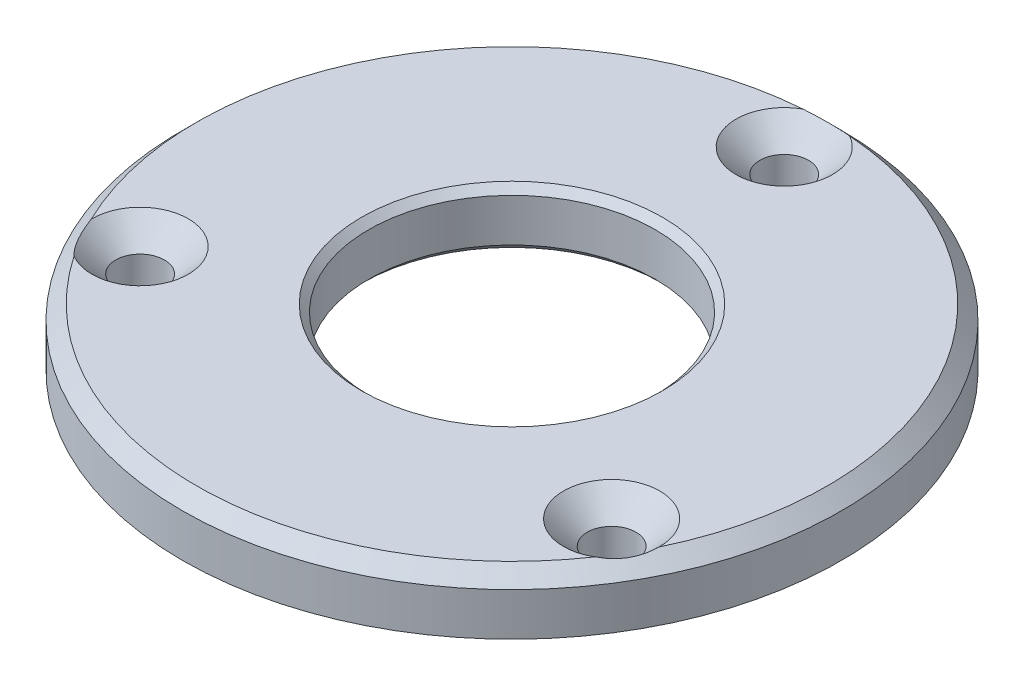
from build123d import *

# Parameters (mm, degrees)
SKETCH1_R                     = 23
SKETCH1_R_2                   = 10
BOSS_EXTRUDE1_DEPTH           = 4
CHAMFER1_SIZE                 = 0.5
CHAMFER2_SIZE                 = 1
CSK_FOR_M3_SFHCS1_D           = 3.4
CSK_FOR_M3_SFHCS1_CSINK_D     = 6.72
CSK_FOR_M3_SFHCS1_CSINK_ANGLE = 90


with BuildPart() as part:
    # Sketch1 → Boss-Extrude1 (new body)
    with BuildSketch(Plane(origin=(0, 0, 0), x_dir=(1, 0, 0), z_dir=(0, 1, 0))):
        Circle(SKETCH1_R)
        Circle(SKETCH1_R_2, mode=Mode.SUBTRACT)
    extrude(amount=BOSS_EXTRUDE1_DEPTH)

    # Chamfer1
    chamfer1_edges = [part.edges().sort_by_distance(p)[0] for p in [
        (-10, 0, 0),
        (-10, 4, 0),
    ]]
    chamfer(chamfer1_edges, length=CHAMFER1_SIZE)

    # Chamfer2
    chamfer2_edges = [part.edges().sort_by_distance(p)[0] for p in [
        (-23, 4, 0),
    ]]
    chamfer(chamfer2_edges, length=CHAMFER2_SIZE)

    # CSK for M3 SFHCS1 (through all)
    with Locations(Plane(origin=(0, 4, 0), x_dir=(1, 0, 0), z_dir=(0, 1, 0))):
        with Locations((0, 19), (16.454482672, -9.5), (-16.454482672, -9.5)):
            CounterSinkHole(CSK_FOR_M3_SFHCS1_D / 2, CSK_FOR_M3_SFHCS1_CSINK_D / 2, counter_sink_angle=CSK_FOR_M3_SFHCS1_CSINK_ANGLE)


solid = part.part
